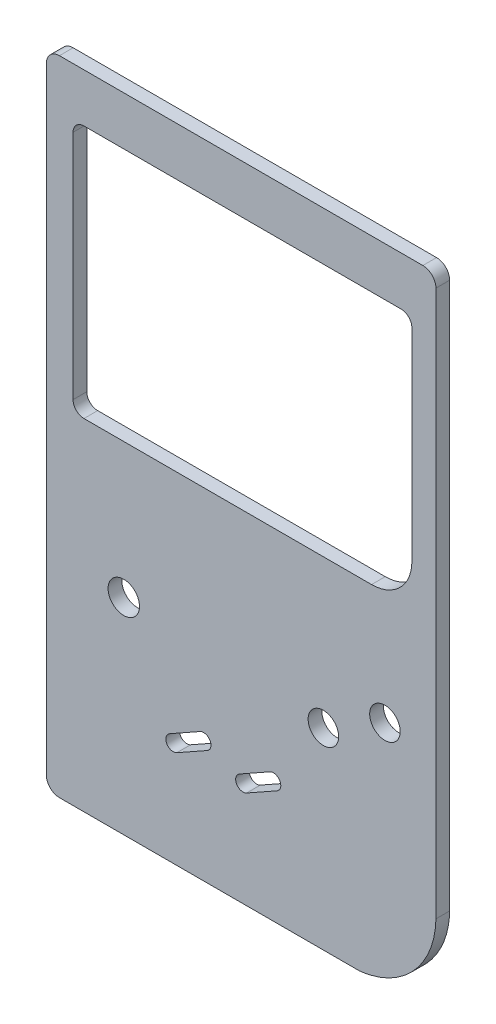
from build123d import *

# Parameters (mm, degrees)
SKETCH1_R           = 3.6
SKETCH1_R_2         = 3.5
BOSS_EXTRUDE1_DEPTH = 3.14


with BuildPart() as part:
    # Sketch1 → Boss-Extrude1 (new body)
    with BuildSketch(Plane.XY):
        with BuildLine():
            add(Edge.make_bspline(
                [(-41.648963672, 73.647136153), (-44.643488897, 73.643488897), (-44.647136153, 70.648963672)],
                knots=[3.927599805, 3.927599805, 3.927599805, 5.497178156, 5.497178156, 5.497178156], degree=2, weights=[1, 0.707537269, 1]))
            Line((-44.647136153, 70.648963672), (-44.647136153, -70.648963672))
            add(Edge.make_bspline(
                [(-44.647136153, -70.648963672), (-44.643488897, -73.643488897), (-41.648963672, -73.647136153)],
                knots=[3.927599805, 3.927599805, 3.927599805, 5.497178156, 5.497178156, 5.497178156], degree=2, weights=[1, 0.707537269, 1]))
            Line((-41.648963672, -73.647136153), (27.093393639, -73.647136153))
            add(Edge.make_bspline(
                [(44.647136153, -54.550700861), (44.629350083, -55.622608831), (44.523578432, -56.687840097), (44.215717336, -58.366181711), (44.071515423, -58.983678353), (43.719242041, -60.213836545), (43.51280516, -60.820227412), (42.807525079, -62.600781834), (42.22206304, -63.742215888), (41.337337041, -65.108539745), (41.152542037, -65.37883334), (40.771685792, -65.906986664), (40.57512321, -66.165654002), (39.967232089, -66.92560473), (39.108255703, -67.89614606), (38.152323748, -68.781197278), (37.146406736, -69.622175477), (36.615243643, -70.022491506), (34.981146078, -71.128530207), (33.83112161, -71.747972893), (32.318701378, -72.376617626), (32.012437216, -72.49499434), (31.392225647, -72.716804064), (31.077608459, -72.820394039), (30.133341911, -73.105042114), (29.500121034, -73.261325902), (28.276366882, -73.499851982), (27.686391293, -73.587126278), (27.093393639, -73.647136153)],
                knots=[0.018260035, 0.018260035, 0.018260035, 0.018260035, 0.125, 0.125, 0.1875, 0.1875, 0.25, 0.25, 0.375, 0.375, 0.40625, 0.40625, 0.4375, 0.4375, 0.5, 0.5625, 0.5625, 0.625, 0.625, 0.75, 0.75, 0.78125, 0.78125, 0.8125, 0.8125, 0.875, 0.875, 0.932610516, 0.932610516, 0.932610516, 0.932610516], degree=3))
            Line((44.647136153, -54.550700861), (44.647136153, 70.648963672))
            add(Edge.make_bspline(
                [(44.647136153, 70.648963672), (44.643488897, 73.643488897), (41.648963672, 73.647136153)],
                knots=[3.927599805, 3.927599805, 3.927599805, 5.497178156, 5.497178156, 5.497178156], degree=2, weights=[1, 0.707537269, 1]))
            Line((41.648963672, 73.647136153), (-41.648963672, 73.647136153))
        make_face()
        with BuildLine():
            Line((39.139308268, 60.005147218), (39.139308268, 13.683084381))
            ThreePointArc((39.139308268, 13.683084381), (36.430045993, 7.142346655), (29.889308268, 4.433084381))
            Line((29.889308268, 4.433084381), (-36.027217939, 4.433084381))
            ThreePointArc((-36.027217939, 4.433084381), (-37.794984892, 5.165317428), (-38.527217939, 6.933084381))
            Line((-38.527217939, 6.933084381), (-38.527217939, 60.005147218))
            ThreePointArc((-38.527217939, 60.005147218), (-37.794984892, 61.772914171), (-36.027217939, 62.505147218))
            Line((-36.027217939, 62.505147218), (36.639308268, 62.505147218))
            ThreePointArc((36.639308268, 62.505147218), (38.40707522, 61.772914171), (39.139308268, 60.005147218))
        make_face(mode=Mode.SUBTRACT)
        with BuildLine():
            ThreePointArc((-14.745996033, -51.265124074), (-17.044884469, -50.621435312), (-16.401195707, -48.322546875))
            Line((-16.401195707, -48.322546875), (-9.42859141, -44.400456958))
            ThreePointArc((-9.42859141, -44.400456958), (-7.129702973, -45.04414572), (-7.773391736, -47.343034157))
            Line((-7.773391736, -47.343034157), (-14.745996033, -51.265124074))
        make_face(mode=Mode.SUBTRACT)
        with Locations((-26.900831216, -26.517202566)):
            Circle(SKETCH1_R, mode=Mode.SUBTRACT)
        with BuildLine():
            ThreePointArc((1.254003967, -51.265124074), (-1.044884469, -50.621435312), (-0.401195707, -48.322546875))
            Line((-0.401195707, -48.322546875), (6.57140859, -44.400456958))
            ThreePointArc((6.57140859, -44.400456958), (8.870297027, -45.04414572), (8.226608264, -47.343034157))
            Line((8.226608264, -47.343034157), (1.254003967, -51.265124074))
        make_face(mode=Mode.SUBTRACT)
        with Locations((18.849494268, -29.546234455)):
            Circle(SKETCH1_R_2, mode=Mode.SUBTRACT)
        with Locations((32.960239, -21.476652312)):
            Circle(SKETCH1_R_2, mode=Mode.SUBTRACT)
    extrude(amount=BOSS_EXTRUDE1_DEPTH)


solid = part.part
